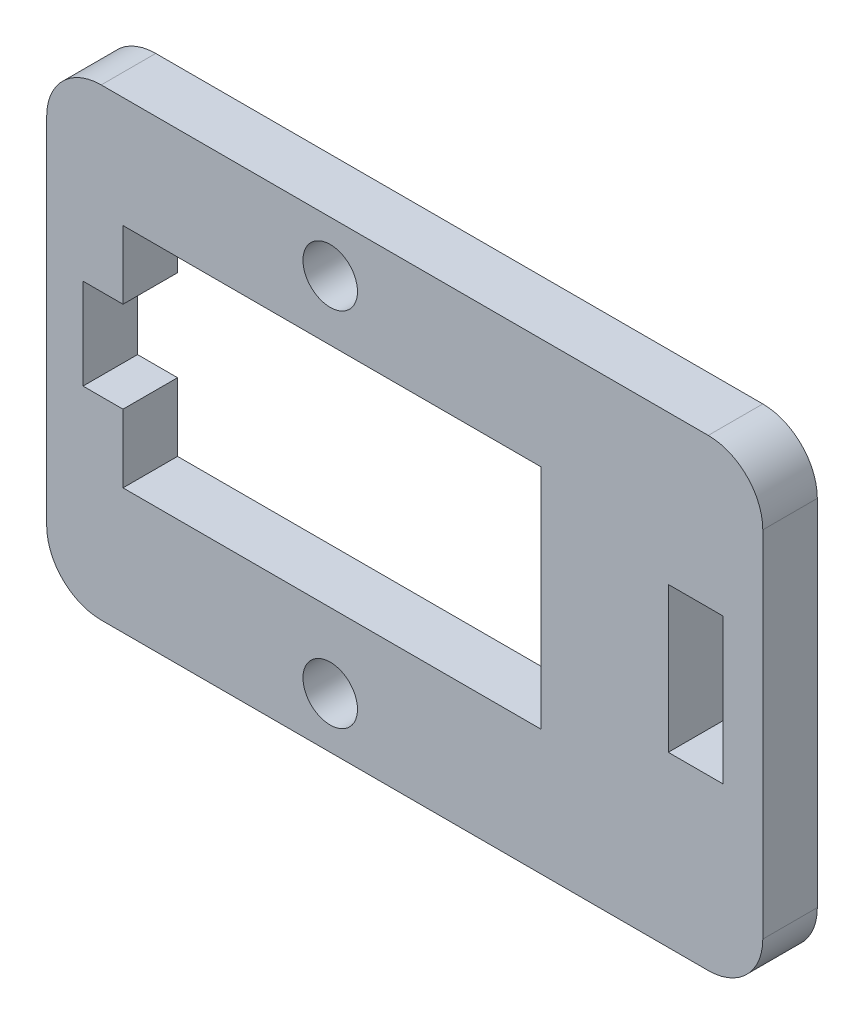
from build123d import *

# Parameters (mm, degrees)
ESQUISSE1_W               = 39.4
ESQUISSE1_H               = 25.5
ESQUISSE1_R               = 1.5
ESQUISSE1_W_2             = 3
ESQUISSE1_H_2             = 8
T_LE_DE_BASE_PLI_E1_DEPTH = 3
CONG_1_R                  = 3


# Sheet-metal steps are written as plain solids
with BuildPart() as part:
    # Esquisse1 → Tôle de base pliée1 (new body)
    with BuildSketch(Plane.XY):
        with Locations((873.243101599, 1995.085790402)):
            Rectangle(ESQUISSE1_W, ESQUISSE1_H)
        with Locations((869.143101599, 2005.035790402)):
            Circle(ESQUISSE1_R, mode=Mode.SUBTRACT)
        with Locations((869.143101599, 1985.135577488)):
            Circle(ESQUISSE1_R, mode=Mode.SUBTRACT)
        Polygon((857.743101599, 1997.985790402), (855.543101599, 1997.985790402), (855.543101599, 1992.985790402), (857.743101599, 1992.985790402), (857.743101599, 1989.235790402), (880.743101599, 1989.235790402), (880.743101599, 2001.735790402), (857.743101599, 2001.735790402), align=None, mode=Mode.SUBTRACT)
        with Locations((889.243101599, 1995.635790402)):
            Rectangle(ESQUISSE1_W_2, ESQUISSE1_H_2, mode=Mode.SUBTRACT)
    extrude(amount=-T_LE_DE_BASE_PLI_E1_DEPTH)

    # Congé1
    cong_1_edges = [part.edges().sort_by_distance(p)[0] for p in [
        (853.543101599, 2007.835790402, -1.5),
        (892.943101599, 2007.835790402, -1.5),
        (892.943101599, 1982.335790402, -1.5),
        (853.543101599, 1982.335790402, -1.5),
    ]]
    fillet(cong_1_edges, radius=CONG_1_R)


solid = part.part
